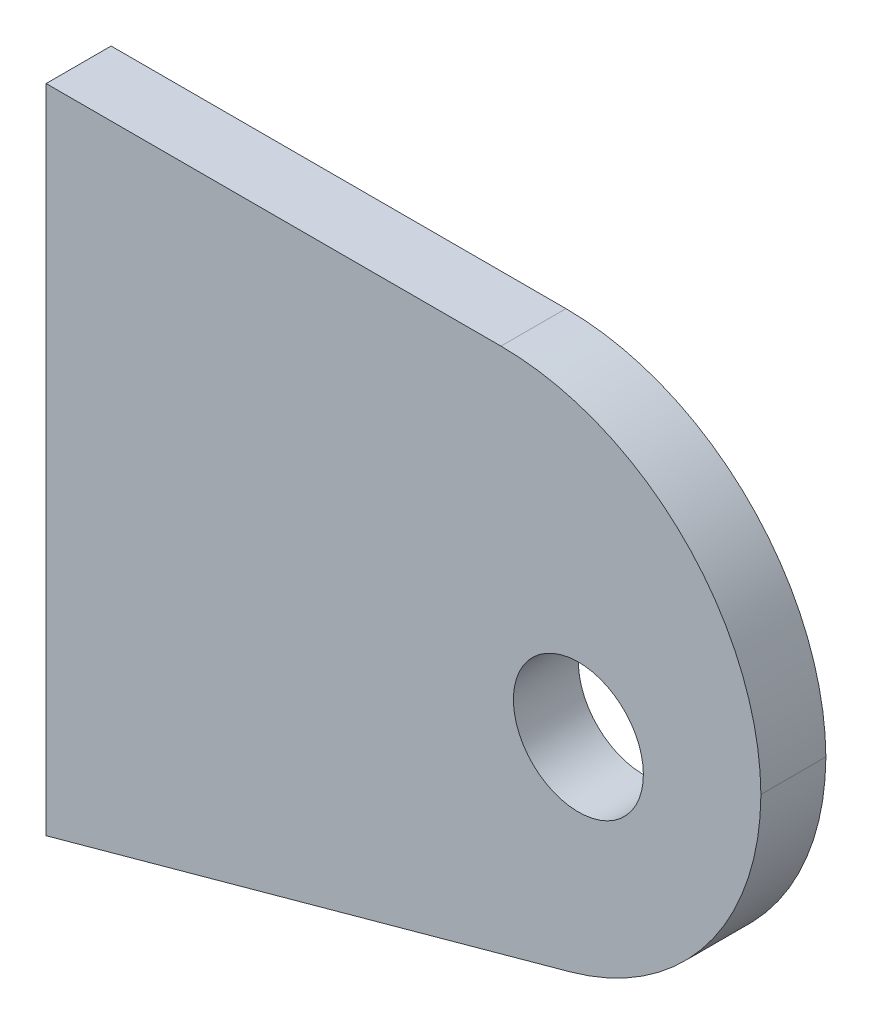
from build123d import *

# Parameters (mm, degrees)
SKETCH1_W                       = 60.458144771
SKETCH1_H                       = 61.20911147
BOSS_EXTRUDE1_DEPTH             = 3.175
F_1_4_0_25_DIAMETER_HOLE1_D     = 6.35
F_1_4_0_25_DIAMETER_HOLE1_DEPTH = 9.268267535
F_1_4_0_25_DIAMETER_HOLE1_TIP   = 1.907732465
CUT_EXTRUDE1_DEPTH              = 46.980601635
FILLET1_R                       = 12.7


with BuildPart() as part:
    # Sketch1 → Boss-Extrude1 (new body)
    with BuildSketch(Plane.XY):
        with Locations((3.939572159, 0)):
            Rectangle(SKETCH1_W, SKETCH1_H)
    extrude(amount=BOSS_EXTRUDE1_DEPTH)

    # 1/4 (0.25) Diameter Hole1
    with Locations(Plane.XY.offset(3.175)):
        with Locations((-0.282440227, 15.955359735)):
            Hole(F_1_4_0_25_DIAMETER_HOLE1_D / 2, depth=F_1_4_0_25_DIAMETER_HOLE1_DEPTH)
            with Locations((0, 0, -(F_1_4_0_25_DIAMETER_HOLE1_DEPTH + F_1_4_0_25_DIAMETER_HOLE1_TIP / 2))):  # 118° drill point
                Cone(0, F_1_4_0_25_DIAMETER_HOLE1_D / 2, F_1_4_0_25_DIAMETER_HOLE1_TIP, mode=Mode.SUBTRACT)

    # Sketch4 → Cut-Extrude1 (cut, through all)
    with BuildSketch(Plane(origin=(0, 0, 0), x_dir=(-1, 0, 0), z_dir=(0, 0, -1))):
        Polygon((26.289500227, -1.224692265), (-8.635499773, 8.379555735), (-8.635499773, 30.604555735), (-34.168644544, 30.604555735), (-34.168644544, -30.604555735), (26.289500227, -30.604555735), align=None)
    extrude(amount=-CUT_EXTRUDE1_DEPTH, mode=Mode.SUBTRACT)

    # Fillet1
    # the kernel refuses this fillet: 12.7 mm, written as the material it takes off along each edge
    with BuildSketch(Plane(origin=(8.635499773, 30.604555735, -31.75), x_dir=(-1, 0, 0), z_dir=(0, 0, 1))) as fillet1_piece_1:
        with BuildLine():
            CenterArc((FILLET1_R, FILLET1_R), FILLET1_R, 180, 90)
            Line((0, FILLET1_R), (0, 0))
            Line((0, 0), (FILLET1_R, 0))
        make_face()
    extrude(amount=66.675, mode=Mode.SUBTRACT)
    with BuildSketch(Plane(origin=(8.635499773, 8.379555735, -24.197503605), x_dir=(0, 1, 0), z_dir=(0, 0, 1))) as fillet1_piece_2:
        with BuildLine():
            CenterArc((FILLET1_R * 0.762126097799, FILLET1_R), FILLET1_R, 195.376057549, 74.623942451)
            Line((-FILLET1_R * 0.202080191414, FILLET1_R * 0.734846776671), (0, 0))
            Line((0, 0), (FILLET1_R * 0.762126097799, 0))
        make_face()
    extrude(amount=51.57000721, mode=Mode.SUBTRACT)


solid = part.part
